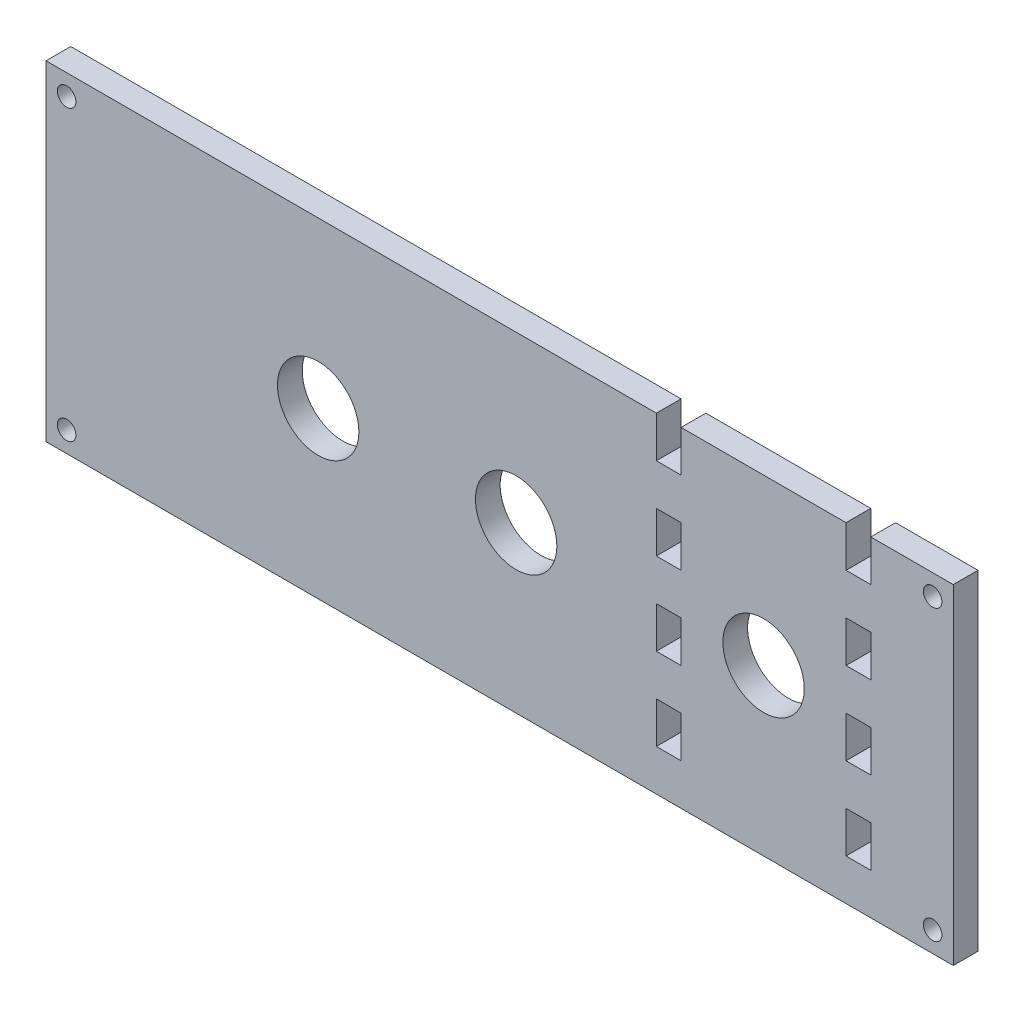
from build123d import *

# Parameters (mm, degrees)
SKETCH1_W           = 110
SKETCH1_H           = 40
BOSS_EXTRUDE1_DEPTH = 3
SKETCH2_W           = 3
SKETCH2_H           = 5
SKETCH2_R           = 4.9365
SKETCH2_R_2         = 1.125
SKETCH2_R_3         = 4.935
CUT_EXTRUDE1_DEPTH  = 118.08543889


with BuildPart() as part:
    # Sketch1 → Boss-Extrude1 (new body)
    with BuildSketch(Plane.XY):
        with Locations((55, 20)):
            Rectangle(SKETCH1_W, SKETCH1_H)
    extrude(amount=BOSS_EXTRUDE1_DEPTH)

    # Sketch2 → Cut-Extrude1 (cut, through all)
    with BuildSketch(Plane.XY.offset(3)):
        with Locations((98.5, 37.5)):
            Rectangle(SKETCH2_W, SKETCH2_H)
        with Locations((75.5, 37.5)):
            Rectangle(SKETCH2_W, SKETCH2_H)
        with Locations((75.5, 27.5)):
            Rectangle(SKETCH2_W, SKETCH2_H)
        with Locations((75.5, 17.5)):
            Rectangle(SKETCH2_W, SKETCH2_H)
        with Locations((75.5, 7.5)):
            Rectangle(SKETCH2_W, SKETCH2_H)
        with Locations((98.5, 27.5)):
            Rectangle(SKETCH2_W, SKETCH2_H)
        with Locations((98.5, 17.5)):
            Rectangle(SKETCH2_W, SKETCH2_H)
        with Locations((98.5, 7.5)):
            Rectangle(SKETCH2_W, SKETCH2_H)
        with Locations((33, 20)):
            Circle(SKETCH2_R)
        with Locations((57, 20)):
            Circle(SKETCH2_R)
        with Locations((2.5, 37.5)):
            Circle(SKETCH2_R_2)
        with Locations((107.5, 37.5)):
            Circle(SKETCH2_R_2)
        with Locations((107.5, 2.5)):
            Circle(SKETCH2_R_2)
        with Locations((2.5, 2.5)):
            Circle(SKETCH2_R_2)
        with Locations((87, 20)):
            Circle(SKETCH2_R_3)
    extrude(amount=-CUT_EXTRUDE1_DEPTH, mode=Mode.SUBTRACT)


solid = part.part
